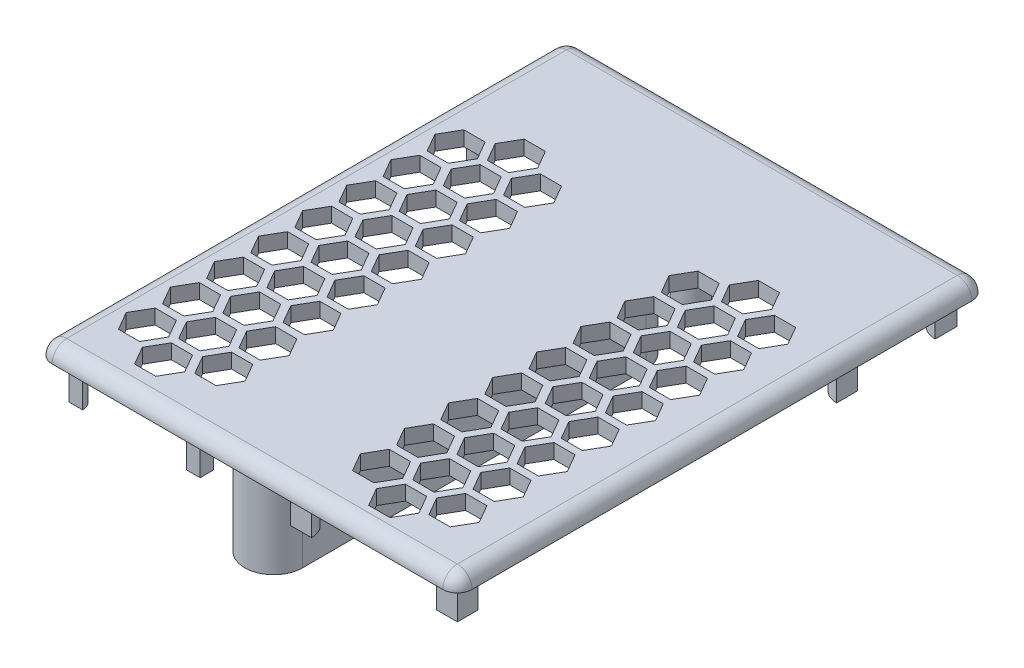
from build123d import *

# Parameters (mm, degrees)
BOSS_EXTRUDE1_DEPTH = 1.5875
BOSS_EXTRUDE2_DEPTH = 10.31875
SKETCH3_R           = 1.905
CUT_EXTRUDE1_DEPTH  = 8.73125
BOSS_EXTRUDE3_DEPTH = 3.95625
BOSS_EXTRUDE4_DEPTH = 4.36625
BOSS_EXTRUDE5_DEPTH = 3.175
FILLET1_R           = 1.5875
FILLET2_R           = 1.5875
CUT_EXTRUDE3_DEPTH  = 50.512521185
FILL_PATTERN1_DEPTH = 1.5875
CUT_EXTRUDE4_DEPTH  = 50.512521185
FILL_PATTERN2_DEPTH = 1.5875


# Read off the part's stored shape, not the designer's step: Fill Pattern1, Fill Pattern2
with BuildPart() as part:
    # Sketch1 → Boss-Extrude1 (new body)
    with BuildSketch(Plane(origin=(0, 0, 0), x_dir=(1, 0, 0), z_dir=(0, 1, 0))):
        with BuildLine():
            Line((10.7145, -21.727), (10.7145, 32.248))
            ThreePointArc((10.7145, 32.248), (10.249532015, 33.370532015), (9.127, 33.8355))
            Line((9.127, 33.8355), (-33.056, 33.8355))
            ThreePointArc((-33.056, 33.8355), (-34.178532015, 33.370532015), (-34.6435, 32.248))
            Line((-34.6435, 32.248), (-34.6435, -21.727))
            ThreePointArc((-34.6435, -21.727), (-34.178532015, -22.849532015), (-33.056, -23.3145))
            Line((-33.056, -23.3145), (9.127, -23.3145))
            ThreePointArc((9.127, -23.3145), (10.249532015, -22.849532015), (10.7145, -21.727))
        make_face()
    extrude(amount=BOSS_EXTRUDE1_DEPTH)

    # Sketch2 → Boss-Extrude2 (add)
    with BuildSketch(Plane.XZ):
        with BuildLine():
            Line((-17.001, -18.552), (-17.001, 18.552))
            ThreePointArc((-17.001, 18.552), (-13.8895, 21.6635), (-10.778, 18.552))
            Line((-10.778, 18.552), (-10.778, -18.552))
            ThreePointArc((-10.778, -18.552), (-13.8895, -21.6635), (-17.001, -18.552))
        make_face()
    extrude(amount=BOSS_EXTRUDE2_DEPTH)

    # Sketch3 → Cut-Extrude1 (cut)
    with BuildSketch(Plane(origin=(0, -10.31875, 0), x_dir=(-1, 0, 0), z_dir=(0, -1, 0))):
        with Locations(Location((13.8895, 18.552, 0), (0, 0, 180))):
            Circle(SKETCH3_R)
        with Locations(Location((13.8895, -18.552, 0), (0, 0, 180))):
            Circle(SKETCH3_R)
    extrude(amount=-CUT_EXTRUDE1_DEPTH, mode=Mode.SUBTRACT)

    # Sketch4 → Boss-Extrude3 (add)
    with BuildSketch(Plane.XZ):
        with BuildLine():
            Line((-9, 21.6), (-9, 19.349139078))
            ThreePointArc((-9, 19.349139078), (-7.408400979, 20.008400979), (-6.749139078, 21.6))
            Line((-6.749139078, 21.6), (-9, 21.6))
        make_face()
        with BuildLine():
            Line((9, 21.6), (6.749139078, 21.6))
            ThreePointArc((6.749139078, 21.6), (7.408400979, 20.008400979), (9, 19.349139078))
            Line((9, 19.349139078), (9, 21.6))
        make_face()
        with BuildLine():
            Line((-9, -21.6), (-6.749139078, -21.6))
            ThreePointArc((-6.749139078, -21.6), (-7.408400979, -20.008400979), (-9, -19.349139078))
            Line((-9, -19.349139078), (-9, -21.6))
        make_face()
        with BuildLine():
            ThreePointArc((6.749139078, -21.6), (7.408400979, -20.008400979), (9, -19.349139078))
            Line((9, -19.349139078), (9, -21.6))
            Line((9, -21.6), (6.749139078, -21.6))
        make_face()
    extrude(amount=BOSS_EXTRUDE3_DEPTH)

    # Sketch4<4> → Boss-Extrude4 (add)
    with BuildSketch(Plane.XZ):
        with BuildLine():
            Line((-32.929, -22.75), (-31.473588154, -22.75))
            ThreePointArc((-31.473588154, -22.75), (-31.899868414, -21.720868414), (-32.929, -21.294588154))
            Line((-32.929, -21.294588154), (-32.929, -22.75))
        make_face()
        with BuildLine():
            ThreePointArc((-20.234411846, -22.75), (-19.808131586, -21.720868414), (-18.779, -21.294588154))
            Line((-18.779, -21.294588154), (-18.779, -22.75))
            Line((-18.779, -22.75), (-20.234411846, -22.75))
        make_face()
        with BuildLine():
            Line((-18.779, 21.6), (-20.234411846, 21.6))
            ThreePointArc((-20.234411846, 21.6), (-19.808131586, 20.570868414), (-18.779, 20.144588154))
            Line((-18.779, 20.144588154), (-18.779, 21.6))
        make_face()
        with BuildLine():
            ThreePointArc((-32.929, 20.144588154), (-31.899868414, 20.570868414), (-31.473588154, 21.6))
            Line((-31.473588154, 21.6), (-32.929, 21.6))
            Line((-32.929, 21.6), (-32.929, 20.144588154))
        make_face()
    extrude(amount=BOSS_EXTRUDE4_DEPTH)

    # Sketch4<5> → Boss-Extrude5 (add)
    with BuildSketch(Plane.XZ):
        with BuildLine():
            ThreePointArc((6.74575, -32.248), (7.443201977, -30.564201977), (9.127, -29.86675))
            Line((9.127, -29.86675), (9.127, -32.248))
            Line((9.127, -32.248), (6.74575, -32.248))
        make_face()
        with BuildLine():
            Line((-33.056, -32.248), (-30.67475, -32.248))
            ThreePointArc((-30.67475, -32.248), (-31.372201977, -30.564201977), (-33.056, -29.86675))
            Line((-33.056, -29.86675), (-33.056, -32.248))
        make_face()
    extrude(amount=BOSS_EXTRUDE5_DEPTH)

    # Fillet1
    fillet1_edges = [part.edges().sort_by_distance(p)[0] for p in [
        (-19.808131586, 0, 20.570868414),
        (-31.899868414, 0, 20.570868414),
        (7.443201977, 0, -30.564201977),
        (-31.372201977, 0, -30.564201977),
        (-13.8895, 0, -21.6635),
        (-10.778, 0, 0),
        (-13.8895, 0, 21.6635),
        (-17.001, 0, 0),
        (-7.408400979, 0, 20.008400979),
        (7.408400979, 0, 20.008400979),
        (-7.408400979, 0, -20.008400979),
        (7.408400979, 0, -20.008400979),
        (-31.899868414, 0, -21.720868414),
        (-19.808131586, 0, -21.720868414),
    ]]
    fillet(fillet1_edges, radius=FILLET1_R)

    # Fillet2
    fillet2_edges = [part.edges().sort_by_distance(p)[0] for p in [
        (10.249532015, 1.5875, -33.370532015),
        (10.7145, 1.5875, -5.2605),
        (10.249532015, 1.5875, 22.849532015),
        (-11.9645, 1.5875, 23.3145),
        (-34.178532015, 1.5875, 22.849532015),
        (-34.6435, 1.5875, -5.2605),
        (-34.178532015, 1.5875, -33.370532015),
        (-11.9645, 1.5875, -33.8355),
    ]]
    fillet(fillet2_edges, radius=FILLET2_R - 0.0001)  # a hair under: the kernel refuses the full size

    # Sketch6 → Cut-Extrude3 (cut, through all)
    with BuildSketch(Plane(origin=(0, 0, 0), x_dir=(-1, 0, 0), z_dir=(0, -1, 0))):
        Polygon((23.562641119, 0.575), (24.70832056, -1.409375), (26.99967944, -1.409375), (28.145358881, 0.575), (26.99967944, 2.559375), (24.70832056, 2.559375), align=None)
    extrude(amount=-CUT_EXTRUDE3_DEPTH, mode=Mode.SUBTRACT)

    # Fill Pattern1 outline → Fill Pattern1 (cut)
    with BuildSketch(Plane(origin=(0, 0, 0), x_dir=(1, 0, 0), z_dir=(0, 1, 0))):
        Polygon((-20.583874574, -8.553125), (-19.438195134, -6.56875), (-20.583874574, -4.584375), (-22.875233455, -4.584375), (-24.020912895, -6.56875), (-22.875233455, -8.553125), align=None)
        Polygon((-28.832766545, 5.734375), (-27.687087105, 7.71875), (-28.832766545, 9.703125), (-31.124125426, 9.703125), (-32.269804866, 7.71875), (-31.124125426, 5.734375), align=None)
        Polygon((-28.832766545, -4.584375), (-31.124125426, -4.584375), (-32.269804866, -6.56875), (-31.124125426, -8.553125), (-28.832766545, -8.553125), (-27.687087105, -6.56875), align=None)
        Polygon((-20.583874574, 9.703125), (-22.875233455, 9.703125), (-24.020912895, 7.71875), (-22.875233455, 5.734375), (-20.583874574, 5.734375), (-19.438195134, 7.71875), align=None)
        Polygon((-24.70832056, -20.459375), (-23.562641119, -18.475), (-24.70832056, -16.490625), (-26.99967944, -16.490625), (-28.145358881, -18.475), (-26.99967944, -20.459375), align=None)
        Polygon((-28.832766545, -13.315625), (-27.687087105, -11.33125), (-28.832766545, -9.346875), (-31.124125426, -9.346875), (-32.269804866, -11.33125), (-31.124125426, -13.315625), align=None)
        Polygon((-20.583874574, -9.346875), (-22.875233455, -9.346875), (-24.020912895, -11.33125), (-22.875233455, -13.315625), (-20.583874574, -13.315625), (-19.438195134, -11.33125), align=None)
        Polygon((-28.832766545, 10.496875), (-27.687087105, 12.48125), (-28.832766545, 14.465625), (-31.124125426, 14.465625), (-32.269804866, 12.48125), (-31.124125426, 10.496875), align=None)
        Polygon((-24.70832056, 3.353125), (-23.562641119, 5.3375), (-24.70832056, 7.321875), (-26.99967944, 7.321875), (-28.145358881, 5.3375), (-26.99967944, 3.353125), align=None)
        Polygon((-20.583874574, -3.790625), (-19.438195134, -1.80625), (-20.583874574, 0.178125), (-22.875233455, 0.178125), (-24.020912895, -1.80625), (-22.875233455, -3.790625), align=None)
        Polygon((-19.438195134, 12.48125), (-20.583874574, 14.465625), (-22.875233455, 14.465625), (-24.020912895, 12.48125), (-22.875233455, 10.496875), (-20.583874574, 10.496875), align=None)
        Polygon((-24.70832056, 21.609375), (-26.99967944, 21.609375), (-28.145358881, 19.625), (-26.99967944, 17.640625), (-24.70832056, 17.640625), (-23.562641119, 19.625), align=None)
        Polygon((-24.70832056, 12.878125), (-23.562641119, 14.8625), (-24.70832056, 16.846875), (-26.99967944, 16.846875), (-28.145358881, 14.8625), (-26.99967944, 12.878125), align=None)
        Polygon((-24.70832056, 8.115625), (-23.562641119, 10.1), (-24.70832056, 12.084375), (-26.99967944, 12.084375), (-28.145358881, 10.1), (-26.99967944, 8.115625), align=None)
        Polygon((-28.832766545, 15.259375), (-27.687087105, 17.24375), (-28.832766545, 19.228125), (-31.124125426, 19.228125), (-32.269804866, 17.24375), (-31.124125426, 15.259375), align=None)
        Polygon((-20.583874574, 0.971875), (-19.438195134, 2.95625), (-20.583874574, 4.940625), (-22.875233455, 4.940625), (-24.020912895, 2.95625), (-22.875233455, 0.971875), align=None)
        Polygon((-20.583874574, 19.228125), (-22.875233455, 19.228125), (-24.020912895, 17.24375), (-22.875233455, 15.259375), (-20.583874574, 15.259375), (-19.438195134, 17.24375), align=None)
        Polygon((-28.832766545, 4.940625), (-31.124125426, 4.940625), (-32.269804866, 2.95625), (-31.124125426, 0.971875), (-28.832766545, 0.971875), (-27.687087105, 2.95625), align=None)
        Polygon((-28.832766545, 0.178125), (-31.124125426, 0.178125), (-32.269804866, -1.80625), (-31.124125426, -3.790625), (-28.832766545, -3.790625), (-27.687087105, -1.80625), align=None)
        Polygon((-24.70832056, -10.934375), (-23.562641119, -8.95), (-24.70832056, -6.965625), (-26.99967944, -6.965625), (-28.145358881, -8.95), (-26.99967944, -10.934375), align=None)
        Polygon((-20.583874574, -18.078125), (-19.438195134, -16.09375), (-20.583874574, -14.109375), (-22.875233455, -14.109375), (-24.020912895, -16.09375), (-22.875233455, -18.078125), align=None)
        Polygon((-28.832766545, -14.109375), (-31.124125426, -14.109375), (-32.269804866, -16.09375), (-31.124125426, -18.078125), (-28.832766545, -18.078125), (-27.687087105, -16.09375), align=None)
        Polygon((-24.70832056, -2.203125), (-26.99967944, -2.203125), (-28.145358881, -4.1875), (-26.99967944, -6.171875), (-24.70832056, -6.171875), (-23.562641119, -4.1875), align=None)
        Polygon((-24.70832056, -11.728125), (-26.99967944, -11.728125), (-28.145358881, -13.7125), (-26.99967944, -15.696875), (-24.70832056, -15.696875), (-23.562641119, -13.7125), align=None)
    extrude(amount=FILL_PATTERN1_DEPTH, mode=Mode.SUBTRACT)

    # Sketch8 → Cut-Extrude4 (cut, through all)
    with BuildSketch(Plane(origin=(0, 0, 0), x_dir=(-1, 0, 0), z_dir=(0, -1, 0))):
        Polygon((-2.291358881, 0), (-1.14567944, -1.984375), (1.14567944, -1.984375), (2.291358881, 0), (1.14567944, 1.984375), (-1.14567944, 1.984375), align=None)
    extrude(amount=-CUT_EXTRUDE4_DEPTH, mode=Mode.SUBTRACT)

    # Fill Pattern2 outline → Fill Pattern2 (cut)
    with BuildSketch(Plane(origin=(0, 0, 0), x_dir=(1, 0, 0), z_dir=(0, 1, 0))):
        Polygon((5.270125426, -9.128125), (6.415804866, -7.14375), (5.270125426, -5.159375), (2.978766545, -5.159375), (1.833087105, -7.14375), (2.978766545, -9.128125), align=None)
        Polygon((-2.978766545, 5.159375), (-1.833087105, 7.14375), (-2.978766545, 9.128125), (-5.270125426, 9.128125), (-6.415804866, 7.14375), (-5.270125426, 5.159375), align=None)
        Polygon((-2.978766545, -5.159375), (-5.270125426, -5.159375), (-6.415804866, -7.14375), (-5.270125426, -9.128125), (-2.978766545, -9.128125), (-1.833087105, -7.14375), align=None)
        Polygon((5.270125426, 9.128125), (2.978766545, 9.128125), (1.833087105, 7.14375), (2.978766545, 5.159375), (5.270125426, 5.159375), (6.415804866, 7.14375), align=None)
        Polygon((1.14567944, -21.034375), (2.291358881, -19.05), (1.14567944, -17.065625), (-1.14567944, -17.065625), (-2.291358881, -19.05), (-1.14567944, -21.034375), align=None)
        Polygon((-2.978766545, -13.890625), (-1.833087105, -11.90625), (-2.978766545, -9.921875), (-5.270125426, -9.921875), (-6.415804866, -11.90625), (-5.270125426, -13.890625), align=None)
        Polygon((5.270125426, -9.921875), (2.978766545, -9.921875), (1.833087105, -11.90625), (2.978766545, -13.890625), (5.270125426, -13.890625), (6.415804866, -11.90625), align=None)
        Polygon((-2.978766545, 9.921875), (-1.833087105, 11.90625), (-2.978766545, 13.890625), (-5.270125426, 13.890625), (-6.415804866, 11.90625), (-5.270125426, 9.921875), align=None)
        Polygon((1.14567944, 2.778125), (2.291358881, 4.7625), (1.14567944, 6.746875), (-1.14567944, 6.746875), (-2.291358881, 4.7625), (-1.14567944, 2.778125), align=None)
        Polygon((5.270125426, -4.365625), (6.415804866, -2.38125), (5.270125426, -0.396875), (2.978766545, -0.396875), (1.833087105, -2.38125), (2.978766545, -4.365625), align=None)
        Polygon((6.415804866, 11.90625), (5.270125426, 13.890625), (2.978766545, 13.890625), (1.833087105, 11.90625), (2.978766545, 9.921875), (5.270125426, 9.921875), align=None)
        Polygon((1.14567944, 21.034375), (-1.14567944, 21.034375), (-2.291358881, 19.05), (-1.14567944, 17.065625), (1.14567944, 17.065625), (2.291358881, 19.05), align=None)
        Polygon((1.14567944, 12.303125), (2.291358881, 14.2875), (1.14567944, 16.271875), (-1.14567944, 16.271875), (-2.291358881, 14.2875), (-1.14567944, 12.303125), align=None)
        Polygon((1.14567944, 7.540625), (2.291358881, 9.525), (1.14567944, 11.509375), (-1.14567944, 11.509375), (-2.291358881, 9.525), (-1.14567944, 7.540625), align=None)
        Polygon((-2.978766545, 14.684375), (-1.833087105, 16.66875), (-2.978766545, 18.653125), (-5.270125426, 18.653125), (-6.415804866, 16.66875), (-5.270125426, 14.684375), align=None)
        Polygon((5.270125426, 0.396875), (6.415804866, 2.38125), (5.270125426, 4.365625), (2.978766545, 4.365625), (1.833087105, 2.38125), (2.978766545, 0.396875), align=None)
        Polygon((5.270125426, 18.653125), (2.978766545, 18.653125), (1.833087105, 16.66875), (2.978766545, 14.684375), (5.270125426, 14.684375), (6.415804866, 16.66875), align=None)
        Polygon((-2.978766545, 4.365625), (-5.270125426, 4.365625), (-6.415804866, 2.38125), (-5.270125426, 0.396875), (-2.978766545, 0.396875), (-1.833087105, 2.38125), align=None)
        Polygon((-2.978766545, -0.396875), (-5.270125426, -0.396875), (-6.415804866, -2.38125), (-5.270125426, -4.365625), (-2.978766545, -4.365625), (-1.833087105, -2.38125), align=None)
        Polygon((1.14567944, -11.509375), (2.291358881, -9.525), (1.14567944, -7.540625), (-1.14567944, -7.540625), (-2.291358881, -9.525), (-1.14567944, -11.509375), align=None)
        Polygon((5.270125426, -18.653125), (6.415804866, -16.66875), (5.270125426, -14.684375), (2.978766545, -14.684375), (1.833087105, -16.66875), (2.978766545, -18.653125), align=None)
        Polygon((-2.978766545, -14.684375), (-5.270125426, -14.684375), (-6.415804866, -16.66875), (-5.270125426, -18.653125), (-2.978766545, -18.653125), (-1.833087105, -16.66875), align=None)
        Polygon((1.14567944, -2.778125), (-1.14567944, -2.778125), (-2.291358881, -4.7625), (-1.14567944, -6.746875), (1.14567944, -6.746875), (2.291358881, -4.7625), align=None)
        Polygon((1.14567944, -12.303125), (-1.14567944, -12.303125), (-2.291358881, -14.2875), (-1.14567944, -16.271875), (1.14567944, -16.271875), (2.291358881, -14.2875), align=None)
    extrude(amount=FILL_PATTERN2_DEPTH, mode=Mode.SUBTRACT)


solid = part.part
